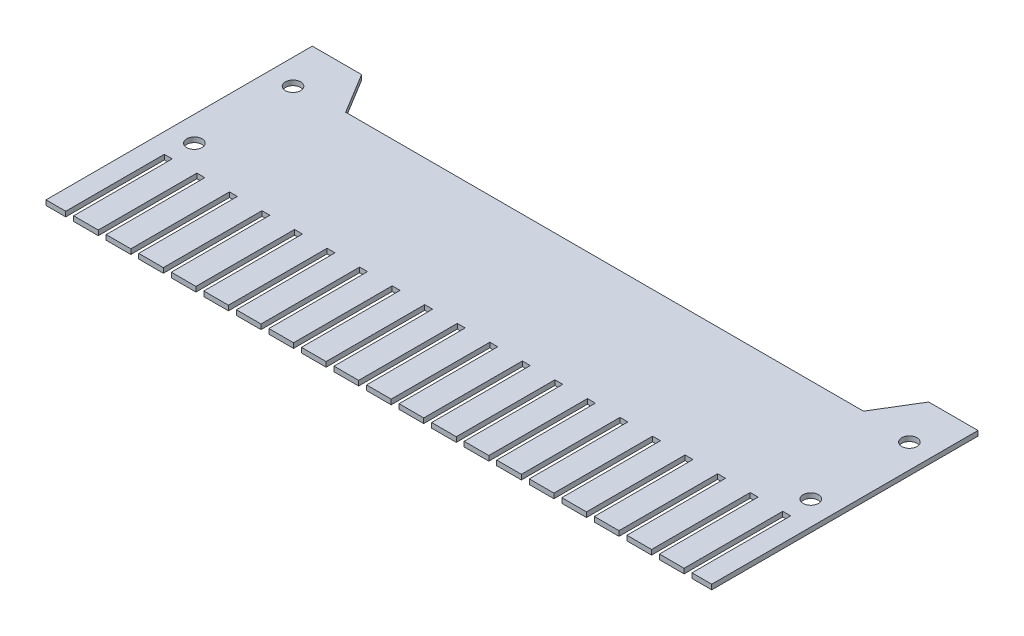
from build123d import *

# Parameters (mm, degrees)
SKETCH1_W           = 135
SKETCH1_H           = 70
BOSS_EXTRUDE1_DEPTH = 1
SKETCH2_W           = 1.6
SKETCH2_H           = 20
CUT_EXTRUDE1_DEPTH  = 3
CUT_EXTRUDE7_DEPTH  = 10
SKETCH8_R           = 1.55
CUT_EXTRUDE8_DEPTH  = 10


with BuildPart() as part:
    # Sketch1 → Boss-Extrude1 (new body)
    with BuildSketch(Plane(origin=(0, 0, 0), x_dir=(1, 0, 0), z_dir=(0, 1, 0))):
        with Locations((-22.07957958, 10.750750751)):
            Rectangle(SKETCH1_W, SKETCH1_H)
    extrude(amount=BOSS_EXTRUDE1_DEPTH)

    # Sketch2 → Cut-Extrude1 (cut)
    with BuildSketch(Plane(origin=(0, 1, 0), x_dir=(1, 0, 0), z_dir=(0, 1, 0))):
        with Locations((-84.77957958, -14.249249249)):
            Rectangle(SKETCH2_W, SKETCH2_H)
        with Locations((-78.17957958, -14.249249249)):
            Rectangle(SKETCH2_W, SKETCH2_H)
        with Locations((-71.57957958, -14.249249249)):
            Rectangle(SKETCH2_W, SKETCH2_H)
        with Locations((-64.97957958, -14.249249249)):
            Rectangle(SKETCH2_W, SKETCH2_H)
        with Locations((-58.37957958, -14.249249249)):
            Rectangle(SKETCH2_W, SKETCH2_H)
        with Locations((-51.77957958, -14.249249249)):
            Rectangle(SKETCH2_W, SKETCH2_H)
        with Locations((-45.17957958, -14.249249249)):
            Rectangle(SKETCH2_W, SKETCH2_H)
        with Locations((-38.57957958, -14.249249249)):
            Rectangle(SKETCH2_W, SKETCH2_H)
        with Locations((-31.97957958, -14.249249249)):
            Rectangle(SKETCH2_W, SKETCH2_H)
        with Locations((-25.37957958, -14.249249249)):
            Rectangle(SKETCH2_W, SKETCH2_H)
        with Locations((-18.77957958, -14.249249249)):
            Rectangle(SKETCH2_W, SKETCH2_H)
        with Locations((-12.17957958, -14.249249249)):
            Rectangle(SKETCH2_W, SKETCH2_H)
        with Locations((-5.57957958, -14.249249249)):
            Rectangle(SKETCH2_W, SKETCH2_H)
        with Locations((1.02042042, -14.249249249)):
            Rectangle(SKETCH2_W, SKETCH2_H)
        with Locations((7.62042042, -14.249249249)):
            Rectangle(SKETCH2_W, SKETCH2_H)
        with Locations((14.22042042, -14.249249249)):
            Rectangle(SKETCH2_W, SKETCH2_H)
        with Locations((20.82042042, -14.249249249)):
            Rectangle(SKETCH2_W, SKETCH2_H)
        with Locations((27.42042042, -14.249249249)):
            Rectangle(SKETCH2_W, SKETCH2_H)
        with Locations((34.02042042, -14.249249249)):
            Rectangle(SKETCH2_W, SKETCH2_H)
        with Locations((40.62042042, -14.249249249)):
            Rectangle(SKETCH2_W, SKETCH2_H)
    extrude(amount=-CUT_EXTRUDE1_DEPTH, mode=Mode.SUBTRACT)

    # Sketch7 → Cut-Extrude7 (cut)
    with BuildSketch(Plane(origin=(0, 1, 0), x_dir=(1, 0, 0), z_dir=(0, 1, 0))):
        Polygon((-89.57957958, 29.750750751), (-79.57957958, 29.750750751), (-74.57957958, 21.526676077), (30.42042042, 21.526676077), (35.42042042, 29.750750751), (45.42042042, 29.750750751), (45.42042042, 45.750750751), (-89.57957958, 45.750750751), align=None)
    extrude(amount=-CUT_EXTRUDE7_DEPTH, mode=Mode.SUBTRACT)

    # Sketch8 → Cut-Extrude8 (cut)
    with BuildSketch(Plane(origin=(0, 1, 0), x_dir=(1, 0, 0), z_dir=(0, 1, 0))):
        with Locations((-84.4891044, 20.750750751)):
            Circle(SKETCH8_R)
        with Locations((-84.4891044, 0.750750751)):
            Circle(SKETCH8_R)
        with Locations((40.5108956, 20.750750751)):
            Circle(SKETCH8_R)
        with Locations((40.5108956, 0.750750751)):
            Circle(SKETCH8_R)
    extrude(amount=-CUT_EXTRUDE8_DEPTH, mode=Mode.SUBTRACT)


solid = part.part
